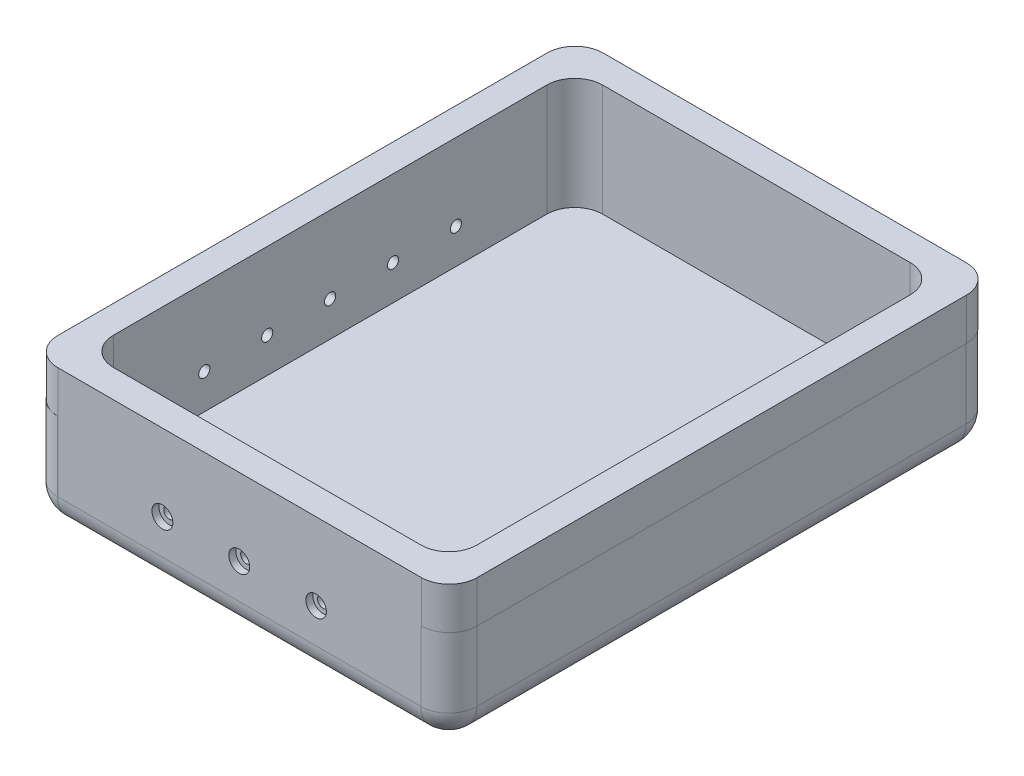
from build123d import *

# Parameters (mm, degrees)
SKETCH1_W                = 5.08
SKETCH1_H                = 5.08
BOSS_EXTRUDE1_DEPTH      = 12.7
SKETCH2_W                = 76.2
SKETCH2_H                = 99.06
BOSS_EXTRUDE2_DEPTH      = 5.08
FILLET1_R                = 5.08
BOSS_EXTRUDE3_DEPTH      = 10.922
BOSS_EXTRUDE3_DEPTH_BACK = 17.78
SKETCH4_R                = 2.032
BOSS_EXTRUDE4_DEPTH      = 12.7
SKETCH7_R                = 1.143
CUT_EXTRUDE4_DEPTH       = 10.922
SKETCH8_R                = 2.032
CUT_EXTRUDE5_DEPTH       = 12.7
SKETCH5_R                = 1.905
SKETCH5_R_2              = 1.866529324
CUT_EXTRUDE6_DEPTH       = 5.08
BOSS_EXTRUDE5_START      = -3.81
SKETCH9_R                = 1.905
SKETCH9_R_2              = 1.016
BOSS_EXTRUDE5_DEPTH      = 3.81
SKETCH6_R                = 1.905
CUT_EXTRUDE7_DEPTH       = 5.08
BOSS_EXTRUDE8_START      = -3.81
SKETCH10_R               = 1.905
SKETCH10_R_2             = 1.016
SKETCH10_R_3             = 2.032
BOSS_EXTRUDE8_DEPTH      = 3.81
SKETCH11_W               = 76.2
SKETCH11_H               = 99.06
SKETCH11_W_2             = 66.04
SKETCH11_H_2             = 88.9
BOSS_EXTRUDE9_DEPTH      = 7.62
FILLET5_R                = 5.08


with BuildPart() as part:
    # Sketch1 → Boss-Extrude1 (new body)
    with BuildSketch(Plane(origin=(0, 0, 0), x_dir=(1, 0, 0), z_dir=(0, 1, 0))):
        Polygon((-5.08, 0), (0, 0), (0, 88.9), (66.04, 88.9), (66.04, 93.98), (-5.08, 93.98), align=None)
        Polygon((66.04, 0), (0, 0), (0, -5.08), (71.12, -5.08), (71.12, 88.9), (66.04, 88.9), align=None)
        with Locations((-2.54, -2.54)):
            Rectangle(SKETCH1_W, SKETCH1_H)
        with Locations((68.58, 91.44)):
            Rectangle(SKETCH1_W, SKETCH1_H)
    extrude(amount=-BOSS_EXTRUDE1_DEPTH)

    # Sketch2 → Boss-Extrude2 (add)
    with BuildSketch(Plane(origin=(0, -12.7, 0), x_dir=(-1, 0, 0), z_dir=(0, -1, 0))):
        with Locations((-33.02, 44.45)):
            Rectangle(SKETCH2_W, SKETCH2_H)
    extrude(amount=BOSS_EXTRUDE2_DEPTH)

    # Fillet1
    fillet1_edges = [part.edges().sort_by_distance(p)[0] for p in [
        (-5.08, -8.89, 5.08),
        (-5.08, -8.89, -93.98),
        (71.12, -8.89, -93.98),
        (71.12, -8.89, 5.08),
        (-5.08, -17.78, -44.45),
        (33.02, -17.78, -93.98),
        (71.12, -17.78, -44.45),
        (33.02, -17.78, 5.08),
    ]]
    fillet(fillet1_edges, radius=FILLET1_R)

    # Sketch3 → Boss-Extrude3 (add, two sides: drawn at the far end of the back side and taken through both)
    with BuildSketch(Plane(origin=(0, 0, 0), x_dir=(1, 0, 0), z_dir=(0, 1, 0)).offset(-BOSS_EXTRUDE3_DEPTH_BACK)):
        with BuildLine():
            ThreePointArc((9.88564537, 14.450599536), (8.800474209, 13.666559912), (9.204047036, 12.390063318))
            Line((9.204047036, 12.390063318), (9.88564537, 13.307599536))
            Line((9.88564537, 13.307599536), (9.88564537, 14.450599536))
        make_face()
        with BuildLine():
            Line((9.88564537, 14.450599536), (9.88564537, 13.307599536))
            Line((9.88564537, 13.307599536), (10.567243703, 14.225135755))
            ThreePointArc((10.567243703, 14.225135755), (10.244605745, 14.392770697), (9.88564537, 14.450599536))
        make_face()
        with BuildLine():
            Line((9.88564537, 13.307599536), (9.204047036, 12.390063318))
            ThreePointArc((9.204047036, 12.390063318), (10.399153941, 12.286444334), (11.02864537, 13.307599536))
            Line((11.02864537, 13.307599536), (9.88564537, 13.307599536))
        make_face()
        with BuildLine():
            Line((10.567243703, 14.225135755), (9.88564537, 13.307599536))
            Line((9.88564537, 13.307599536), (11.02864537, 13.307599536))
            ThreePointArc((11.02864537, 13.307599536), (10.906800572, 13.821108107), (10.567243703, 14.225135755))
        make_face()
        with BuildLine():
            ThreePointArc((55.472756297, 14.225135755), (55.133199428, 13.821108107), (55.01135463, 13.307599536))
            Line((55.01135463, 13.307599536), (56.15435463, 13.307599536))
            Line((56.15435463, 13.307599536), (55.472756297, 14.225135755))
        make_face()
        with BuildLine():
            Line((56.15435463, 13.307599536), (55.01135463, 13.307599536))
            ThreePointArc((55.01135463, 13.307599536), (55.640846059, 12.286444334), (56.835952964, 12.390063318))
            Line((56.835952964, 12.390063318), (56.15435463, 13.307599536))
        make_face()
        with BuildLine():
            Line((56.15435463, 14.450599536), (56.15435463, 13.307599536))
            Line((56.15435463, 13.307599536), (56.835952964, 12.390063318))
            ThreePointArc((56.835952964, 12.390063318), (57.175509833, 12.794090965), (57.29735463, 13.307599536))
            ThreePointArc((57.29735463, 13.307599536), (56.962577681, 14.115822587), (56.15435463, 14.450599536))
        make_face()
        with BuildLine():
            Line((55.472756297, 14.225135755), (56.15435463, 13.307599536))
            Line((56.15435463, 13.307599536), (56.15435463, 14.450599536))
            ThreePointArc((56.15435463, 14.450599536), (55.795394255, 14.392770697), (55.472756297, 14.225135755))
        make_face()
        with BuildLine():
            ThreePointArc((55.01135463, 75.592400464), (55.133199428, 75.078891893), (55.472756297, 74.674864245))
            Line((55.472756297, 74.674864245), (56.15435463, 75.592400464))
            Line((56.15435463, 75.592400464), (55.01135463, 75.592400464))
        make_face()
        with BuildLine():
            Line((55.01135463, 75.592400464), (56.15435463, 75.592400464))
            Line((56.15435463, 75.592400464), (56.835952964, 76.509936682))
            ThreePointArc((56.835952964, 76.509936682), (55.640846059, 76.613555666), (55.01135463, 75.592400464))
        make_face()
        with BuildLine():
            Line((56.15435463, 75.592400464), (55.472756297, 74.674864245))
            ThreePointArc((55.472756297, 74.674864245), (55.795394255, 74.507229303), (56.15435463, 74.449400464))
            Line((56.15435463, 74.449400464), (56.15435463, 75.592400464))
        make_face()
        with BuildLine():
            Line((56.835952964, 76.509936682), (56.15435463, 75.592400464))
            Line((56.15435463, 75.592400464), (56.15435463, 74.449400464))
            ThreePointArc((56.15435463, 74.449400464), (56.962577681, 74.784177413), (57.29735463, 75.592400464))
            ThreePointArc((57.29735463, 75.592400464), (57.175509833, 76.105909035), (56.835952964, 76.509936682))
        make_face()
        with BuildLine():
            ThreePointArc((9.204047036, 76.509936682), (8.800474209, 75.233440088), (9.88564537, 74.449400464))
            Line((9.88564537, 74.449400464), (9.88564537, 75.592400464))
            Line((9.88564537, 75.592400464), (9.204047036, 76.509936682))
        make_face()
        with BuildLine():
            Line((9.88564537, 75.592400464), (9.88564537, 74.449400464))
            ThreePointArc((9.88564537, 74.449400464), (10.244605745, 74.507229303), (10.567243703, 74.674864245))
            Line((10.567243703, 74.674864245), (9.88564537, 75.592400464))
        make_face()
        with BuildLine():
            Line((11.02864537, 75.592400464), (9.88564537, 75.592400464))
            Line((9.88564537, 75.592400464), (10.567243703, 74.674864245))
            ThreePointArc((10.567243703, 74.674864245), (10.906800572, 75.078891893), (11.02864537, 75.592400464))
        make_face()
        with BuildLine():
            Line((9.204047036, 76.509936682), (9.88564537, 75.592400464))
            Line((9.88564537, 75.592400464), (11.02864537, 75.592400464))
            ThreePointArc((11.02864537, 75.592400464), (10.399153941, 76.613555666), (9.204047036, 76.509936682))
        make_face()
    extrude(amount=BOSS_EXTRUDE3_DEPTH + BOSS_EXTRUDE3_DEPTH_BACK)

    # Sketch4 → Boss-Extrude4 (add)
    with BuildSketch(Plane(origin=(0, 0, 0), x_dir=(1, 0, 0), z_dir=(0, 1, 0))):
        with Locations(Location((56.15435463, 13.307599536, 0), (0, 0, 270))):
            Circle(SKETCH4_R)
        with Locations(Location((9.88564537, 13.307599536, 0), (0, 0, 270))):
            Circle(SKETCH4_R)
        with Locations(Location((56.15435463, 75.592400464, 0), (0, 0, 270))):
            Circle(SKETCH4_R)
        with Locations(Location((9.88564537, 75.592400464, 0), (0, 0, 270))):
            Circle(SKETCH4_R)
    extrude(amount=-BOSS_EXTRUDE4_DEPTH)

    # Sketch7 → Cut-Extrude4 (cut)
    with BuildSketch(Plane(origin=(0, 10.922, 0), x_dir=(1, 0, 0), z_dir=(0, 1, 0))):
        with Locations((56.15435463, 75.592400464)):
            Circle(SKETCH7_R)
        with Locations((9.88564537, 75.592400464)):
            Circle(SKETCH7_R)
        with Locations((56.15435463, 13.307599536)):
            Circle(SKETCH7_R)
        with Locations((9.88564537, 13.307599536)):
            Circle(SKETCH7_R)
    extrude(amount=-CUT_EXTRUDE4_DEPTH, mode=Mode.SUBTRACT)

    # Sketch8 → Cut-Extrude5 (cut)
    with BuildSketch(Plane(origin=(0, 0, 0), x_dir=(1, 0, 0), z_dir=(0, 1, 0))):
        with Locations((56.15435463, 13.307599536)):
            Circle(SKETCH8_R)
        with Locations((56.15435463, 75.592400464)):
            Circle(SKETCH8_R)
        with Locations((9.88564537, 75.592400464)):
            Circle(SKETCH8_R)
        with Locations((9.88564537, 13.307599536)):
            Circle(SKETCH8_R)
    extrude(amount=-CUT_EXTRUDE5_DEPTH, mode=Mode.SUBTRACT)

    # Sketch5 → Cut-Extrude6 (cut)
    with BuildSketch(Plane.XY.offset(5.08)):
        with Locations((19.05, -6.35)):
            Circle(SKETCH5_R)
        with BuildLine():
            ThreePointArc((33.02, -4.445), (31.806803172, -4.881266377), (31.149277719, -5.990245715))
            Line((31.149277719, -5.990245715), (33.02, -6.35))
            Line((33.02, -6.35), (34.890722281, -5.990245715))
            ThreePointArc((34.890722281, -5.990245715), (34.233196828, -4.881266377), (33.02, -4.445))
        make_face()
        with BuildLine():
            Line((33.02, -6.35), (31.149277719, -5.990245715))
            ThreePointArc((31.149277719, -5.990245715), (31.115, -6.35), (31.149277719, -6.709754285))
            Line((31.149277719, -6.709754285), (33.02, -6.35))
        make_face()
        with BuildLine():
            Line((34.890722281, -5.990245715), (33.02, -6.35))
            Line((33.02, -6.35), (34.890722281, -6.709754285))
            ThreePointArc((34.890722281, -6.709754285), (34.916411209, -6.530691801), (34.925, -6.35))
            ThreePointArc((34.925, -6.35), (34.916411209, -6.169308199), (34.890722281, -5.990245715))
        make_face()
        with BuildLine():
            Line((34.890722281, -6.709754285), (33.02, -6.35))
            Line((33.02, -6.35), (31.149277719, -6.709754285))
            ThreePointArc((31.149277719, -6.709754285), (31.806803172, -7.818733623), (33.02, -8.255))
            ThreePointArc((33.02, -8.255), (34.233196828, -7.818733623), (34.890722281, -6.709754285))
        make_face()
        with Locations((46.98994703, -6.388470676)):
            Circle(SKETCH5_R_2)
    extrude(amount=-CUT_EXTRUDE6_DEPTH, mode=Mode.SUBTRACT)

    # Sketch9 → Boss-Extrude5 (add)
    # profile 1 of 3: a face of its own
    with BuildSketch(Plane(origin=(0, 0, 0), x_dir=(-1, 0, 0), z_dir=(0, 0, -1)).offset(BOSS_EXTRUDE5_START)):
        with Locations((-46.98994703, -6.388470676)):
            Circle(SKETCH9_R)
        with Locations((-46.98994703, -6.388470676)):
            Circle(SKETCH9_R_2, mode=Mode.SUBTRACT)
    # profile 2 of 3: a face of its own
    with BuildSketch(Plane(origin=(0, 0, 0), x_dir=(-1, 0, 0), z_dir=(0, 0, -1)).offset(BOSS_EXTRUDE5_START)):
        with Locations(Location((-33.02, -6.35, 0), (0, 0, 180))):
            Circle(SKETCH9_R)
        with Locations((-33.02, -6.35)):
            Circle(SKETCH9_R_2, mode=Mode.SUBTRACT)
    # profile 3 of 3: a face of its own
    with BuildSketch(Plane(origin=(0, 0, 0), x_dir=(-1, 0, 0), z_dir=(0, 0, -1)).offset(BOSS_EXTRUDE5_START)):
        with Locations(Location((-19.05, -6.35, 0), (0, 0, 180))):
            Circle(SKETCH9_R)
        with Locations((-19.05, -6.35)):
            Circle(SKETCH9_R_2, mode=Mode.SUBTRACT)
    extrude(amount=BOSS_EXTRUDE5_DEPTH)

    # Sketch6 → Cut-Extrude7 (cut)
    with BuildSketch(Plane.ZY.offset(5.08)):
        with BuildLine():
            Line((-54.653499975, -4.892357146), (-56.649300025, -4.607242854))
            ThreePointArc((-56.649300025, -4.607242854), (-57.785, -6.35), (-56.649300025, -8.092757146))
            Line((-56.649300025, -8.092757146), (-54.653499975, -7.807642854))
            ThreePointArc((-54.653499975, -7.807642854), (-53.975, -6.35), (-54.653499975, -4.892357146))
        make_face()
        with Locations((-67.31, -6.35)):
            Circle(SKETCH6_R)
        with Locations((-44.45, -6.35)):
            Circle(SKETCH6_R)
        with BuildLine():
            Line((-32.217974947, -4.60256785), (-34.279225053, -4.89703215))
            ThreePointArc((-34.279225053, -4.89703215), (-34.942696883, -6.35), (-34.279225053, -7.80296785))
            Line((-34.279225053, -7.80296785), (-32.217974947, -8.09743215))
            ThreePointArc((-32.217974947, -8.09743215), (-31.097303117, -6.35), (-32.217974947, -4.60256785))
        make_face()
        with Locations((-21.59, -6.35)):
            Circle(SKETCH6_R)
    extrude(amount=-CUT_EXTRUDE7_DEPTH, mode=Mode.SUBTRACT)

    # Sketch10 → Boss-Extrude8 (add)
    # profile 1 of 5: a face of its own
    with BuildSketch(Plane(origin=(0, 0, 0), x_dir=(0, 0, -1), z_dir=(1, 0, 0)).offset(BOSS_EXTRUDE8_START)):
        with Locations(Location((21.59, -6.35, 0), (0, 0, 180))):
            Circle(SKETCH10_R)
        with Locations((21.59, -6.35)):
            Circle(SKETCH10_R_2, mode=Mode.SUBTRACT)
    # profile 2 of 5: a face of its own
    with BuildSketch(Plane(origin=(0, 0, 0), x_dir=(0, 0, -1), z_dir=(1, 0, 0)).offset(BOSS_EXTRUDE8_START)):
        with Locations((33.02, -6.35)):
            Circle(SKETCH10_R_3)
        with Locations((33.02, -6.35)):
            Circle(SKETCH10_R_2, mode=Mode.SUBTRACT)
    # profile 3 of 5: a face of its own
    with BuildSketch(Plane(origin=(0, 0, 0), x_dir=(0, 0, -1), z_dir=(1, 0, 0)).offset(BOSS_EXTRUDE8_START)):
        with Locations(Location((44.45, -6.35, 0), (0, 0, 180))):
            Circle(SKETCH10_R)
        with Locations((44.45, -6.35)):
            Circle(SKETCH10_R_2, mode=Mode.SUBTRACT)
    # profile 4 of 5: a face of its own
    with BuildSketch(Plane(origin=(0, 0, 0), x_dir=(0, 0, -1), z_dir=(1, 0, 0)).offset(BOSS_EXTRUDE8_START)):
        with Locations((55.88, -6.35)):
            Circle(SKETCH10_R)
        with Locations((55.88, -6.35)):
            Circle(SKETCH10_R_2, mode=Mode.SUBTRACT)
    # profile 5 of 5: a face of its own
    with BuildSketch(Plane(origin=(0, 0, 0), x_dir=(0, 0, -1), z_dir=(1, 0, 0)).offset(BOSS_EXTRUDE8_START)):
        with Locations(Location((67.31, -6.35, 0), (0, 0, 180))):
            Circle(SKETCH10_R)
        with Locations((67.31, -6.35)):
            Circle(SKETCH10_R_2, mode=Mode.SUBTRACT)
    extrude(amount=BOSS_EXTRUDE8_DEPTH)

    # Sketch11 → Boss-Extrude9 (add)
    with BuildSketch(Plane(origin=(0, 0, 0), x_dir=(1, 0, 0), z_dir=(0, 1, 0))):
        with Locations((33.084815263, 44.45)):
            Rectangle(SKETCH11_W, SKETCH11_H)
        with Locations((33.02, 44.45)):
            Rectangle(SKETCH11_W_2, SKETCH11_H_2, mode=Mode.SUBTRACT)
    extrude(amount=BOSS_EXTRUDE9_DEPTH)

    # Fillet5
    # the kernel refuses this fillet: 5.08 mm, written as the material it adds along each edge
    with BuildSketch(Plane(origin=(66.04, -12.7, 0), x_dir=(0, 0, -1), z_dir=(0, 1, 0)), Plane(origin=(0, -12.7, -88.9), x_dir=(0, 0, 1), z_dir=(0, 1, 0))) as fillet5_piece_1:
        with BuildLine():
            CenterArc((FILLET5_R, FILLET5_R), FILLET5_R, 180, 90)
            Line((0, FILLET5_R), (-FILLET5_R * 0.02, FILLET5_R))
            Line((-FILLET5_R * 0.02, FILLET5_R), (-FILLET5_R * 0.02, -FILLET5_R * 0.02))
            Line((-FILLET5_R * 0.02, -FILLET5_R * 0.02), (FILLET5_R, -FILLET5_R * 0.02))
            Line((FILLET5_R, -FILLET5_R * 0.02), (FILLET5_R, 0))
        make_face()
    extrude(amount=20.32)
    with BuildSketch(Plane(origin=(0, -12.7, 0), x_dir=(0, 0, -1), z_dir=(0, 1, 0)), Plane(origin=(66.04, 7.62, -88.9), x_dir=(-1, 0, 0), z_dir=(0, -1, 0))) as fillet5_piece_2:
        with BuildLine():
            CenterArc((FILLET5_R, -FILLET5_R), FILLET5_R, 90, 90)
            Line((0, -FILLET5_R), (-FILLET5_R * 0.02, -FILLET5_R))
            Line((-FILLET5_R * 0.02, -FILLET5_R), (-FILLET5_R * 0.02, FILLET5_R * 0.02))
            Line((-FILLET5_R * 0.02, FILLET5_R * 0.02), (FILLET5_R, FILLET5_R * 0.02))
            Line((FILLET5_R, FILLET5_R * 0.02), (FILLET5_R, 0))
        make_face()
    extrude(amount=20.32)
    # the kernel refuses this fillet: 5.08 mm, written as the material it takes off along each edge
    with BuildSketch(Plane(origin=(71.184815263, 0, -93.98), x_dir=(-1, 0, 0), z_dir=(0, 1, 0)), Plane(origin=(-5.015184737, 0, -93.98), x_dir=(0, 0, 1), z_dir=(0, 1, 0))) as fillet5_2_piece_1:
        with BuildLine():
            CenterArc((FILLET5_R, FILLET5_R), FILLET5_R, 180, 90)
            Line((0, FILLET5_R), (-FILLET5_R * 0.02, FILLET5_R))
            Line((-FILLET5_R * 0.02, FILLET5_R), (-FILLET5_R * 0.02, -FILLET5_R * 0.02))
            Line((-FILLET5_R * 0.02, -FILLET5_R * 0.02), (FILLET5_R, -FILLET5_R * 0.02))
            Line((FILLET5_R, -FILLET5_R * 0.02), (FILLET5_R, 0))
        make_face()
    extrude(amount=7.62, mode=Mode.SUBTRACT)
    with BuildSketch(Plane(origin=(71.184815263, 0, 5.08), x_dir=(-1, 0, 0), z_dir=(0, 1, 0)), Plane(origin=(-5.015184737, 0, 5.08), x_dir=(0, 0, -1), z_dir=(0, 1, 0))) as fillet5_2_piece_2:
        with BuildLine():
            CenterArc((FILLET5_R, -FILLET5_R), FILLET5_R, 90, 90)
            Line((0, -FILLET5_R), (-FILLET5_R * 0.02, -FILLET5_R))
            Line((-FILLET5_R * 0.02, -FILLET5_R), (-FILLET5_R * 0.02, FILLET5_R * 0.02))
            Line((-FILLET5_R * 0.02, FILLET5_R * 0.02), (FILLET5_R, FILLET5_R * 0.02))
            Line((FILLET5_R, FILLET5_R * 0.02), (FILLET5_R, 0))
        make_face()
    extrude(amount=7.62, mode=Mode.SUBTRACT)


solid = part.part
